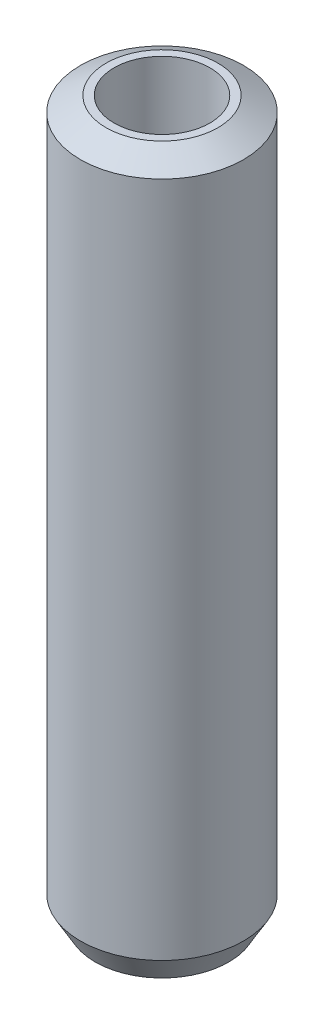
from build123d import *
from OCP.BRepFilletAPI import BRepFilletAPI_MakeChamfer

# Parameters (mm, degrees)
SKETCH1_R           = 7.5
BOSS_EXTRUDE1_DEPTH = 65.921249597
SKETCH2_R           = 4.405848929
CUT_EXTRUDE1_DEPTH  = 67.76908827
CHAMFER1_SIZE       = 1.359942647
CHAMFER1_SIZE2      = 2.35548976


with BuildPart() as part:
    # Sketch1 → Boss-Extrude1 (new body)
    with BuildSketch(Plane(origin=(0, 0, 0), x_dir=(1, 0, 0), z_dir=(0, 1, 0))):
        Circle(SKETCH1_R)
    extrude(amount=BOSS_EXTRUDE1_DEPTH)

    # Sketch2 → Cut-Extrude1 (cut, through all)
    with BuildSketch(Plane(origin=(0, 0, 0), x_dir=(1, 0, 0), z_dir=(0, 1, 0))):
        Circle(SKETCH2_R)
    extrude(amount=CUT_EXTRUDE1_DEPTH, mode=Mode.SUBTRACT)

    # Chamfer1: one chamfer whose edges measure the first distance from different faces: ONE call of the kernel's chamfer builder (chamfer() names one face for all edges)
    chamfer1_edges_1 = [part.edges().sort_by_distance(p)[0] for p in [
        (-7.5, 65.921249597, 0),
    ]]
    chamfer1_side_1 = [part.faces().sort_by_distance(p)[0] for p in [
        (-7.5, 32.960624798, 0),
    ]]
    chamfer1_edges_2 = [part.edges().sort_by_distance(p)[0] for p in [
        (-7.5, 0, 0),
    ]]
    chamfer1_side_2 = [part.faces().sort_by_distance(p)[0] for p in [
        (-7.287867966, 0, 0),
    ]]
    chamfer1 = BRepFilletAPI_MakeChamfer(part.part.solid().wrapped)
    for e in chamfer1_edges_1:
        chamfer1.Add(CHAMFER1_SIZE, CHAMFER1_SIZE2, e.wrapped, chamfer1_side_1[0].wrapped)  # the first distance lies on this face
    for e in chamfer1_edges_2:
        chamfer1.Add(CHAMFER1_SIZE, CHAMFER1_SIZE2, e.wrapped, chamfer1_side_2[0].wrapped)  # the first distance lies on this face
    add(Compound.cast(chamfer1.Shape()), mode=Mode.REPLACE)


solid = part.part
